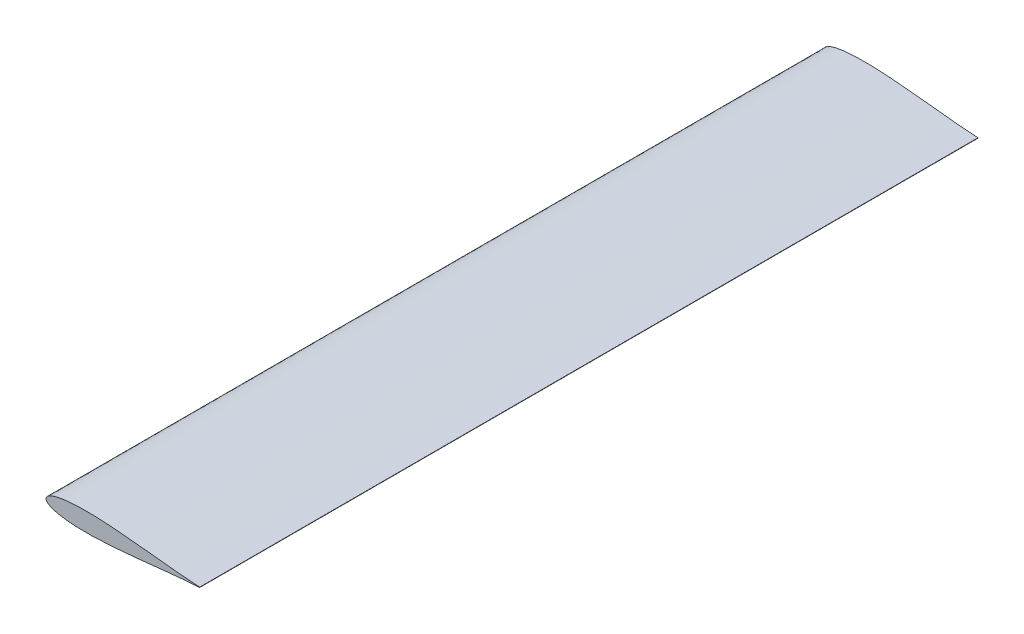
from build123d import *

# Parameters (mm, degrees)
BOSS_EXTRUDE4_DEPTH = 609.6


with BuildPart() as part:
    # Sketch2 → Boss-Extrude4 (new body)
    with BuildSketch(Plane.XY):
        with BuildLine():
            Line((120.380960043, 0.131910968), (120.380960043, -0.13191095))
            add(Edge.make_bspline(
                [(120.380960043, 0.131910968), (119.946341591, 0.152711182), (118.879825678, 0.207805593), (117.085778754, 0.313677955), (114.917831353, 0.458373703), (112.492651454, 0.638201877), (109.822798753, 0.85371931), (106.921074515, 1.105960198), (103.801681225, 1.393960866), (100.47971538, 1.715903258), (96.971509885, 2.06983989), (93.294019085, 2.451783389), (89.46526698, 2.85749965), (85.503826568, 3.28175384), (81.429064058, 3.718670433), (77.260785731, 4.161966443), (73.019254019, 4.604126338), (68.725181462, 5.03833015), (64.399395462, 5.456362411), (60.063068942, 5.851187181), (55.737197625, 6.214504538), (51.442917043, 6.539202929), (47.201068222, 6.818142459), (43.032378562, 7.044765483), (38.957075624, 7.213123875), (34.99505353, 7.318061293), (31.165536986, 7.354994119), (27.487176119, 7.320854727), (23.977851472, 7.213318692), (20.654583842, 7.030920877), (17.533565736, 6.773866125), (14.629816575, 6.443235187), (11.957394826, 6.041513529), (9.529072463, 5.571825351), (7.356345225, 5.038900712), (5.449154243, 4.448412935), (3.815756487, 3.806735364), (2.462434378, 3.120688392), (1.392845645, 2.396403236), (0.609563184, 1.636816588), (0.117367124, 0.838378891), (-0.055284763, 3e-09), (0.117367124, -0.838378885), (0.609563184, -1.636816583), (1.392845646, -2.396403226), (2.462434375, -3.120688405), (3.815756504, -3.806735267), (5.449154164, -4.44841335), (7.35634558, -5.03889881), (9.529110457, -5.571843411), (11.957441548, -6.041483938), (14.629855539, -6.443250824), (17.533566272, -6.773862839), (20.654583684, -7.030921839), (23.977851518, -7.213318406), (27.487176105, -7.320854803), (31.165536989, -7.354994091), (34.995053529, -7.318061295), (38.957075624, -7.213123869), (43.032378562, -7.044765479), (47.201068221, -6.818142456), (51.442917042, -6.539202923), (55.737197626, -6.214504544), (60.063068938, -5.851187144), (64.399395475, -5.456362534), (68.725181412, -5.038329681), (73.019254201, -4.604128053), (77.260826096, -4.161955886), (81.429107504, -3.718688804), (85.503866958, -3.281743582), (89.46526714, -2.857501142), (93.294019045, -2.45178302), (96.971509892, -2.069839946), (100.479715387, -1.715903365), (103.80168119, -1.393960421), (106.921074635, -1.105961717), (109.82283955, -0.853710658), (112.492693973, -0.638215275), (114.917872344, -0.458367158), (117.085778817, -0.313678794), (118.879825669, -0.207805471), (119.946341589, -0.152711137), (120.380960043, -0.13191095)],
                knots=[0.016066336, 0.016066336, 0.016066336, 0.016066336, 0.021198496, 0.028708349, 0.037278223, 0.046867658, 0.057430489, 0.068916541, 0.081270768, 0.094432341, 0.108338211, 0.122918813, 0.138103257, 0.15381535, 0.169977616, 0.186508903, 0.203327313, 0.220348626, 0.237487597, 0.254659894, 0.271779428, 0.288762762, 0.305526624, 0.321990034, 0.338073446, 0.353702279, 0.368802604, 0.383306141, 0.397148829, 0.410269485, 0.422614248, 0.43413286, 0.444782857, 0.454526749, 0.463337037, 0.471194285, 0.478091852, 0.484041802, 0.489081613, 0.493295092, 0.496841712, 0.500000002, 0.503158291, 0.506704912, 0.510918391, 0.515958202, 0.521908151, 0.528805719, 0.536662967, 0.545473255, 0.555217627, 0.56586714, 0.577385752, 0.589730516, 0.602851171, 0.61669386, 0.631197396, 0.646297721, 0.661926555, 0.678009966, 0.694473376, 0.711237238, 0.728220572, 0.745340106, 0.762512403, 0.779651374, 0.796672688, 0.813491097, 0.830022871, 0.84618465, 0.861896743, 0.877081188, 0.891661789, 0.90556766, 0.918729232, 0.93108346, 0.942569511, 0.953132831, 0.962721777, 0.971291651, 0.978801504, 0.983933664, 0.983933664, 0.983933664, 0.983933664], degree=3))
        make_face()
    extrude(amount=BOSS_EXTRUDE4_DEPTH)


solid = part.part
